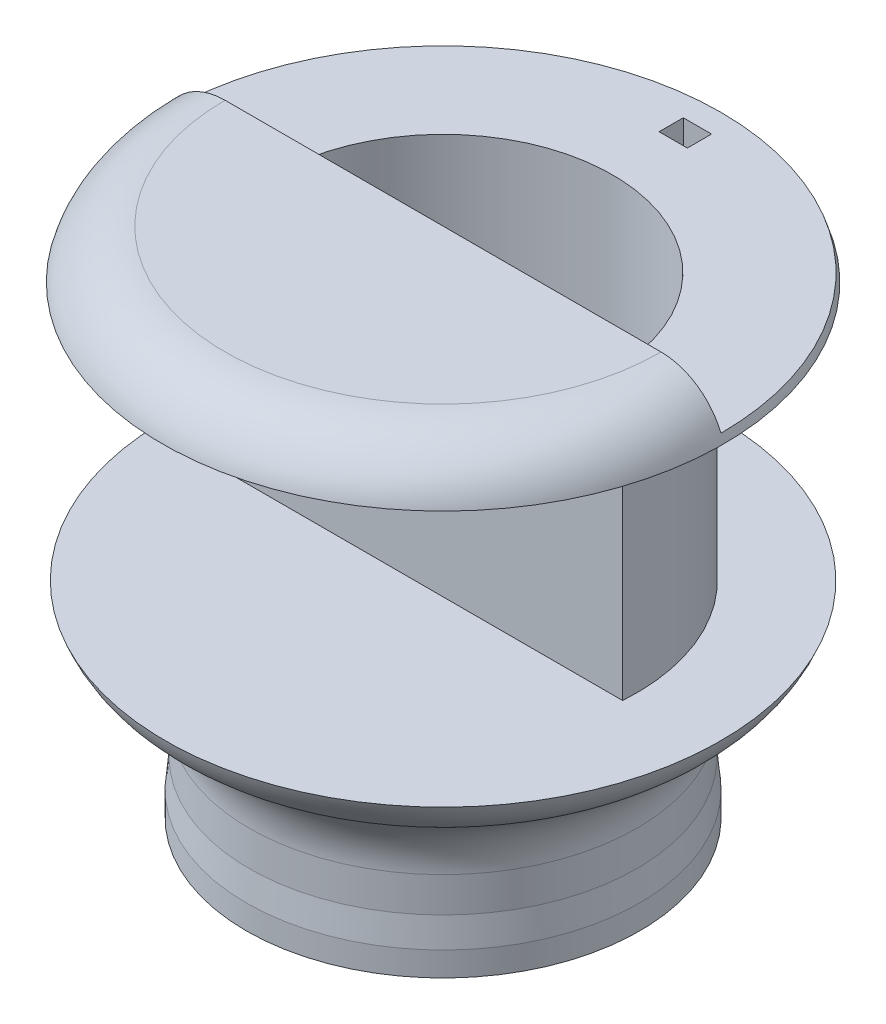
from build123d import *

# Parameters (mm, degrees)
CUT_EXTRUDE3_DEPTH      = 60
CUT_EXTRUDE5_DEPTH      = 2
CUT_EXTRUDE5_DEPTH_BACK = 30
SKETCH21_W              = 3.25
SKETCH21_H              = 4
BOSS_EXTRUDE3_DEPTH     = 1.35
CIRPATTERN1_COUNT       = 5
CUT_EXTRUDE9_DEPTH      = 5
SKETCH24_W              = 12
SKETCH24_H              = 5
BOSS_EXTRUDE4_DEPTH     = 8
SKETCH26_W              = 3.5
SKETCH26_H              = 3
CUT_EXTRUDE11_DEPTH     = 10
SKETCH27_W              = 3.921277394
SKETCH27_H              = 5.980215438
CUT_EXTRUDE12_DEPTH     = 5


with BuildPart() as part:
    # Sketch1 → Revolve1 (revolve)
    with BuildSketch(Plane.XY):
        with BuildLine():
            Line((0, 63.427876097), (27, 63.427876097))
            ThreePointArc((27, 63.427876097), (32.656854249, 61.084730346), (35, 55.427876097))
            Line((35, 55.427876097), (35, 28.846818009))
            ThreePointArc((35, 28.846818009), (33.792081772, 24.082439968), (30.460140376, 20.469057744))
            Line((30.460140376, 20.469057744), (28.539859624, 19.217529634))
            ThreePointArc((28.539859624, 19.217529634), (25.207918228, 15.604147409), (24, 10.839769368))
            Line((24, 10.839769368), (24, 6.50871128))
            Line((24, 6.50871128), (24.35, 3))
            Line((24.35, 3), (24.35, 0))
            Line((24.35, 0), (22.5, 0))
            Line((22.5, 0), (22.5, 12.5))
            ThreePointArc((22.5, 12.5), (22.353553391, 12.853553391), (22, 13))
            Line((22, 13), (0, 13))
            Line((0, 13), (0, 63.427876097))
        make_face()
    revolve(axis=Axis((0, 0, 0), (0, 1, 0)))

    # Sketch11 → Cut-Extrude3 (cut)
    with BuildSketch(Plane(origin=(0, 13, 0), x_dir=(-1, 0, 0), z_dir=(0, -1, 0))):
        with BuildLine():
            Line((-21, 0), (21, 0))
            ThreePointArc((21, 0), (0, 21), (-21, 0))
        make_face()
    extrude(amount=-CUT_EXTRUDE3_DEPTH, mode=Mode.SUBTRACT)

    # Sketch9 → Cut-Extrude5 (cut, two sides: drawn at the far end of the back side and taken through both)
    with BuildSketch(Plane(origin=(0, 55.427876097, 0), x_dir=(1, 0, 0), z_dir=(0, 1, 0)).offset(-CUT_EXTRUDE5_DEPTH_BACK)):
        with BuildLine():
            ThreePointArc((-37, -1.601545046), (-0.398454954, -39), (37, -2.398454954))
            ThreePointArc((37, -2.398454954), (0.398454954, 35), (-37, -1.601545046))
        make_face()
        with BuildLine():
            Line((-24, -1.763080838), (24, -1.763080838))
            ThreePointArc((24, -1.763080838), (0, 24), (-24, -1.763080838))
        make_face(mode=Mode.SUBTRACT)
    extrude(amount=CUT_EXTRUDE5_DEPTH + CUT_EXTRUDE5_DEPTH_BACK, mode=Mode.SUBTRACT)

    # Sketch21 → Boss-Extrude3 (add)
    with BuildSketch(Plane(origin=(0, 0, 22.5), x_dir=(-1, 0, 0), z_dir=(0, 0, -1))):
        with Locations((0, 2)):
            Rectangle(SKETCH21_W, SKETCH21_H)
    boss_extrude3 = extrude(amount=BOSS_EXTRUDE3_DEPTH)

    # CirPattern1: Boss-Extrude3 ×5 about axis
    cirpattern1_axis = Axis((0, 0, 0), (0, -1, 0))
    for i in range(1, CIRPATTERN1_COUNT):
        add(boss_extrude3.rotate(cirpattern1_axis, i * 360 / CIRPATTERN1_COUNT))

    # Sketch22 → Cut-Extrude9 (cut)
    with BuildSketch(Plane(origin=(0, 63.427876097, 0), x_dir=(1, 0, 0), z_dir=(0, 1, 0))):
        with BuildLine():
            Line((-40, 0), (40, 0))
            ThreePointArc((40, 0), (0, 40), (-40, 0))
        make_face()
    extrude(amount=-CUT_EXTRUDE9_DEPTH, mode=Mode.SUBTRACT)

    # Sketch24 → Boss-Extrude4 (add)
    with BuildSketch(Plane(origin=(0, 58.427876097, 0), x_dir=(1, 0, 0), z_dir=(0, 1, 0))):
        with Locations((0, 30)):
            Rectangle(SKETCH24_W, SKETCH24_H)
    extrude(amount=-BOSS_EXTRUDE4_DEPTH)

    # Sketch26 → Cut-Extrude11 (cut)
    with BuildSketch(Plane(origin=(0, 58.427876097, 0), x_dir=(1, 0, 0), z_dir=(0, 1, 0))):
        with Locations((0, 30)):
            Rectangle(SKETCH26_W, SKETCH26_H)
    extrude(amount=-CUT_EXTRUDE11_DEPTH, mode=Mode.SUBTRACT)

    # Sketch27 → Cut-Extrude12 (cut)
    with BuildSketch(Plane(origin=(6, 0, 0), x_dir=(0, 0, -1), z_dir=(1, 0, 0))):
        with Locations((30, 53.927876097)):
            Rectangle(SKETCH27_W, SKETCH27_H)
    extrude(amount=-CUT_EXTRUDE12_DEPTH, mode=Mode.SUBTRACT)


solid = part.part
